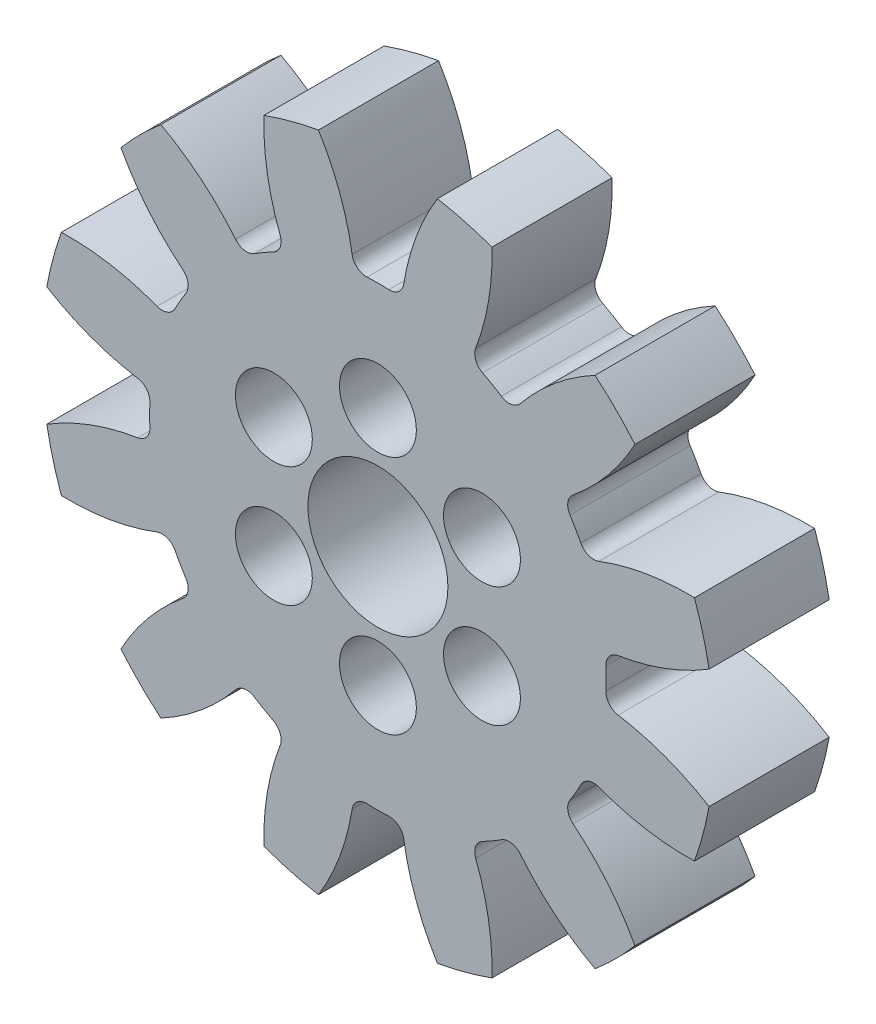
from build123d import *

# Parameters (mm, degrees)
SKETCH1_R                = 14
BOSS_EXTRUDE1_DEPTH      = 2.5
CUT_EXTRUDE1_DEPTH       = 20.956202043
FILLET1_R                = 0.6
FILLET2_R                = 0.6
CIRPATTERN2_COUNT        = 12
FILLET1_OF_CIRPATTERN2_R = 0.6
FILLET2_OF_CIRPATTERN2_R = 0.6
CUT_EXTRUDE2_DEPTH       = 21.118127499
CUT_EXTRUDE2_DEPTH_BACK  = 21.118127499
SKETCH4_R                = 3
SKETCH4_R_2              = 1.5
SKETCH5_R                = 1.6
CUT_EXTRUDE3_DEPTH       = 21.118127499
DRAFT1_ANGLE             = 1


with BuildPart() as part:
    # Sketch1 → Boss-Extrude1 (new, symmetric)
    with BuildSketch(Plane.XY):
        Circle(SKETCH1_R)
    extrude(amount=BOSS_EXTRUDE1_DEPTH, both=True)

    # Sketch2 → Cut-Extrude1 (cut, symmetric)
    with BuildSketch(Plane.XY):
        with BuildLine():
            ThreePointArc((-3.314591405, 14.951229823), (-1.751535203, 12.36983933), (-0.999747632, 9.447248524))
            ThreePointArc((-0.999747632, 9.447248524), (0, 9.5), (0.999747632, 9.447248524))
            ThreePointArc((0.999747632, 9.447248524), (1.751535203, 12.36983933), (3.314591405, 14.951229823))
            ThreePointArc((3.314591405, 14.951229823), (0, 15.314234862), (-3.314591405, 14.951229823))
        make_face()
    cut_extrude1 = extrude(amount=CUT_EXTRUDE1_DEPTH, both=True, mode=Mode.SUBTRACT)

    # Fillet1
    fillet1_edges = [part.edges().sort_by_distance(p)[0] for p in [
        (-0.999747632, 9.447248524, 0),
    ]]
    fillet(fillet1_edges, radius=FILLET1_R)

    # Fillet2
    fillet2_edges = [part.edges().sort_by_distance(p)[0] for p in [
        (0.999747632, 9.447248524, 0),
    ]]
    fillet(fillet2_edges, radius=FILLET2_R)

    # CirPattern2: Cut-Extrude1 ×12 about axis
    cirpattern2_axis = Axis((0, 0, 2.5), (0, 0, 1))
    for i in range(1, CIRPATTERN2_COUNT):
        add(cut_extrude1.rotate(cirpattern2_axis, i * 360 / CIRPATTERN2_COUNT), mode=Mode.SUBTRACT)

    # Fillet1 of CirPattern2
    fillet1_of_cirpattern2_edges = [part.edges().sort_by_distance(p)[0] for p in [
        (-5.589431109, 7.681683401, 0),
        (-8.681431034, 3.857817415, 0),
        (-9.447248524, -0.999747632, 0),
        (-7.681683401, -5.589431109, 0),
        (-3.857817415, -8.681431034, 0),
        (0.999747632, -9.447248524, 0),
        (5.589431109, -7.681683401, 0),
        (8.681431034, -3.857817415, 0),
        (9.447248524, 0.999747632, 0),
        (7.681683401, 5.589431109, 0),
        (3.857817415, 8.681431034, 0),
    ]]
    fillet(fillet1_of_cirpattern2_edges, radius=FILLET1_OF_CIRPATTERN2_R)

    # Fillet2 of CirPattern2
    fillet2_of_cirpattern2_edges = [part.edges().sort_by_distance(p)[0] for p in [
        (-3.857817415, 8.681431034, 0),
        (-7.681683401, 5.589431109, 0),
        (-9.447248524, 0.999747632, 0),
        (-8.681431034, -3.857817415, 0),
        (-5.589431109, -7.681683401, 0),
        (-0.999747632, -9.447248524, 0),
        (3.857817415, -8.681431034, 0),
        (7.681683401, -5.589431109, 0),
        (9.447248524, -0.999747632, 0),
        (8.681431034, 3.857817415, 0),
        (5.589431109, 7.681683401, 0),
    ]]
    fillet(fillet2_of_cirpattern2_edges, radius=FILLET2_OF_CIRPATTERN2_R)

    # Sketch4 → Cut-Extrude2 (cut, two sides: drawn at the far end of the back side and taken through both)
    with BuildSketch(Plane.XY.offset(2.5).offset(-CUT_EXTRUDE2_DEPTH_BACK)):
        Circle(SKETCH4_R)
        with Locations((0, 5)):
            Circle(SKETCH4_R_2)
        with Locations((4.330127019, 2.5)):
            Circle(SKETCH4_R_2)
        with Locations((4.330127019, -2.5)):
            Circle(SKETCH4_R_2)
        with Locations((0, -5)):
            Circle(SKETCH4_R_2)
        with Locations((-4.330127019, -2.5)):
            Circle(SKETCH4_R_2)
        with Locations((-4.330127019, 2.5)):
            Circle(SKETCH4_R_2)
    extrude(amount=CUT_EXTRUDE2_DEPTH + CUT_EXTRUDE2_DEPTH_BACK, mode=Mode.SUBTRACT)

    # Sketch5 → Cut-Extrude3 (cut, through all)
    with BuildSketch(Plane.XY.offset(2.5)):
        with Locations((0, 5)):
            Circle(SKETCH5_R)
        with Locations((4.330127019, 2.5)):
            Circle(SKETCH5_R)
        with Locations((4.330127019, -2.5)):
            Circle(SKETCH5_R)
        with Locations((0, -5)):
            Circle(SKETCH5_R)
        Circle(SKETCH5_R)
        with Locations((-4.330127019, -2.5)):
            Circle(SKETCH5_R)
        with Locations((-4.330127019, 2.5)):
            Circle(SKETCH5_R)
    extrude(amount=-CUT_EXTRUDE3_DEPTH, mode=Mode.SUBTRACT)

    # Draft1
    draft1_faces = [part.faces().sort_by_distance(p)[0] for p in [
        (-3, 0, 0),
    ]]
    draft(draft1_faces, Plane(origin=(0, 0, -2.5), x_dir=(-1, 0, 0), z_dir=(0, 0, -1)), DRAFT1_ANGLE)


solid = part.part
